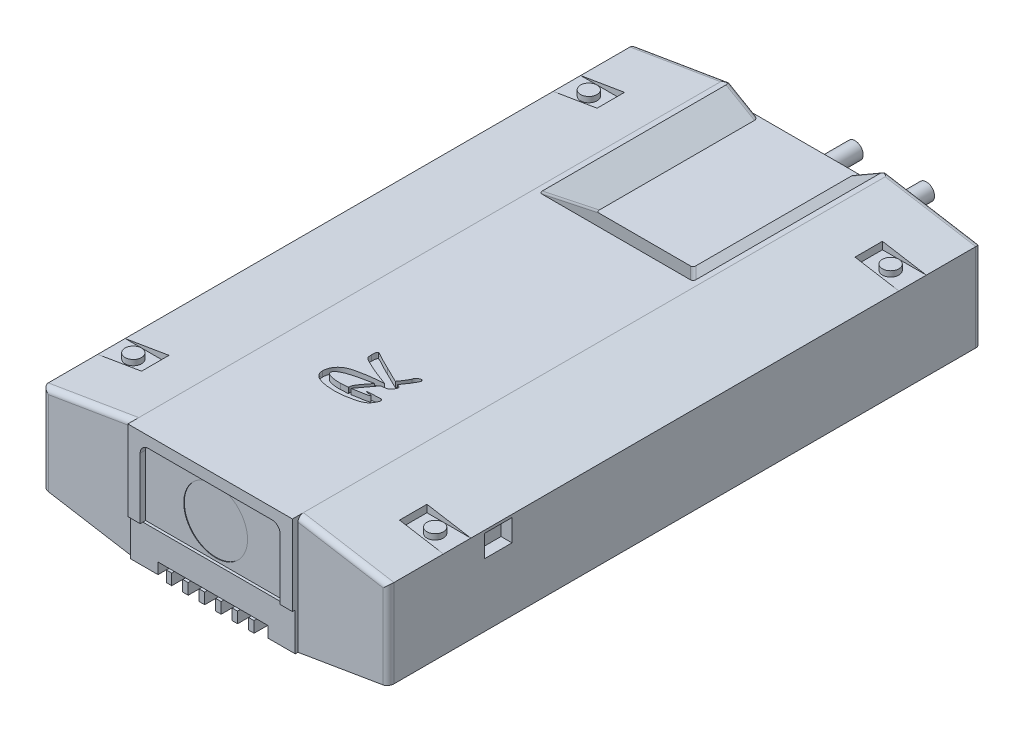
from build123d import *

# Parameters (mm, degrees)
EXTRUDE_1_DEPTH        = 109
SKETCH_2_W             = 20
SKETCH_2_H             = 4
CUT_EXTRUDE_1_DEPTH    = 109
SKETCH_5_R             = 3
EXTRUDE_2_DEPTH        = 5
SKETCH_6_R             = 1.5
EXTRUDE_3_DEPTH        = 10
SKETCH_7_W             = 28
SKETCH_7_H             = 50
CUT_EXTRUDE_3_DEPTH    = 3
CUT_EXTRUDE_3_DRAFT    = -60
CUT_EXTRUDE_4_DEPTH    = 1
SKETCH_9_OUTSIDE_W     = 93.148
SKETCH_9_OUTSIDE_H     = 51.688
SKETCH_9_OUTSIDE_W_2   = 30
SKETCH_9_OUTSIDE_H_2   = 21.54
CUT_EXTRUDE_5_DEPTH    = 1
SKETCH_10_W            = 30
SKETCH_10_H            = 6.9196852
CUT_EXTRUDE_6_DEPTH    = 1
EXTRUDE_7_DEPTH        = 0.5
SKETCH_11_W            = 8
SKETCH_11_H            = 5
CUT_EXTRUDE_7_DEPTH    = 2.77
SKETCH_25_R            = 5.8101574
CUT_EXTRUDE_12_DEPTH   = 0.1
SKETCH_13_W            = 5
SKETCH_13_H            = 4
CUT_EXTRUDE_9_DEPTH    = 2
SKETCH_15_W            = 1
SKETCH_15_H            = 2
EXTRUDE_4_DEPTH        = 109
SKETCH_16_R            = 1.5
EXTRUDE_5_DEPTH        = 1
FILLET_1_R             = 1
SKETCH_22_W            = 6.062177826
SKETCH_22_H            = 3.5
EXTRUDE_6_DEPTH        = 2
HOLE_WIZARD_M2_1_D     = 1.6
HOLE_WIZARD_M2_1_DEPTH = 4
HOLE_WIZARD_M2_1_TIP   = 0.480688495


with BuildPart() as part:
    # 草图1 → 凸台-拉伸1 (new body)
    with BuildSketch(Plane.XY):
        Polygon((-15, 10.77), (-31.5, 8), (-31.5, -8), (-15, -10.77), (15, -10.77), (31.5, -8), (31.5, 8), (15, 10.77), align=None)
    extrude(amount=EXTRUDE_1_DEPTH)

    # 草图2 → 切除-拉伸1 (cut)
    with BuildSketch(Plane.XY.offset(109)):
        with Locations((0, -10.77)):
            Rectangle(SKETCH_2_W, SKETCH_2_H)
    extrude(amount=-CUT_EXTRUDE_1_DEPTH, mode=Mode.SUBTRACT)

    # 草图5 → 凸台-拉伸2 (add)
    with BuildSketch(Plane(origin=(0, 0, 0), x_dir=(-1, 0, 0), z_dir=(0, 0, -1))):
        with Locations((-6.5, -3.77)):
            Circle(SKETCH_5_R)
        with Locations(Location((6.5, -3.77, 0), (0, 0, 180))):
            Circle(SKETCH_5_R)
    extrude(amount=EXTRUDE_2_DEPTH)

    # 草图6 → 凸台-拉伸3 (add)
    with BuildSketch(Plane(origin=(0, 0, -5), x_dir=(-1, 0, 0), z_dir=(0, 0, -1))):
        with Locations((-6.5, -3.77)):
            Circle(SKETCH_6_R)
        with Locations(Location((6.5, -3.77, 0), (0, 0, 180))):
            Circle(SKETCH_6_R)
    extrude(amount=EXTRUDE_3_DEPTH)


with BuildPart() as cut_extrude_3_tool:
    # 草图7 → 切除-拉伸3 (with draft: the straight prism first)
    with BuildSketch(Plane(origin=(0, 10.77, 0), x_dir=(1, 0, 0), z_dir=(0, 1, 0))):
        with Locations((0, -10)):
            Rectangle(SKETCH_7_W, SKETCH_7_H)
    extrude(amount=-CUT_EXTRUDE_3_DEPTH)
    # 切除-拉伸3: the draft: its side faces are tilted about the plane it starts from
    cut_extrude_3_sides = [cut_extrude_3_tool.faces().sort_by_distance(p)[0] for p in [
        (14, 9.27, 10),
        (0, 9.27, -15),
        (-14, 9.27, 10),
        (0, 9.27, 35),
    ]]
    draft(cut_extrude_3_sides, Plane(origin=(0, 10.77, 0), x_dir=(1, 0, 0), z_dir=(0, 1, 0)), CUT_EXTRUDE_3_DRAFT)


with BuildPart() as part_1:
    add(part.part)

    # 切除-拉伸3: cut by cut_extrude_3_tool
    add(cut_extrude_3_tool.part, mode=Mode.SUBTRACT)

    # 草图8 → 切除-拉伸4 (cut)
    with BuildSketch(Plane(origin=(0, 10.77, 0), x_dir=(1, 0, 0), z_dir=(0, 1, 0))):
        with BuildLine():
            Line((-0.091520411, -76.564537784), (2.64396346, -77.902172193))
            add(Edge.make_bspline(
                [(2.64396346, -77.902172193), (2.725905855, -77.789789697), (2.882375365, -77.575194627), (3.101687638, -77.267143229), (3.291495381, -76.986659861), (3.453486994, -76.73649393), (3.584347164, -76.513771452), (3.691704307, -76.323337104), (3.76909467, -76.160399066), (3.803161726, -76.058745125), (3.818157009, -76.01400015)],
                knots=[0, 0, 0, 0, 1.496497705, 2.857571612, 4.068387203, 5.140297685, 6.063603348, 6.847221219, 7.492581812, 8, 8, 8, 8], degree=3))
            add(Edge.make_bspline(
                [(3.818157009, -76.01400015), (3.83529868, -75.95857865), (3.869207697, -75.848945901), (3.959186877, -75.700833924), (4.072227864, -75.5676167), (4.208177919, -75.455472485), (4.349670891, -75.363307957), (4.48558258, -75.296533491), (4.60879672, -75.250594689), (4.688811363, -75.244681889), (4.72568389, -75.241957139)],
                knots=[0, 0, 0, 0, 1.100917803, 2.177794642, 3.271921831, 4.414937538, 5.520499694, 6.478917125, 7.299051179, 8, 8, 8, 8], degree=3))
            add(Edge.make_bspline(
                [(4.72568389, -75.241957139), (4.767396068, -75.244083061), (4.843908451, -75.247982627), (4.942710034, -75.306651425), (5.001378832, -75.405453008), (5.005278398, -75.481965391), (5.00740432, -75.523677569)],
                knots=[0, 0, 0, 0, 1.090337967, 2, 2.909662033, 4, 4, 4, 4], degree=3))
            add(Edge.make_bspline(
                [(5.00740432, -75.523677569), (5.005824937, -75.540285238), (5.001962692, -75.58089785), (4.976906424, -75.649192874), (4.943315224, -75.737915547), (4.892821191, -75.844178447), (4.83038237, -75.969962391), (4.752127331, -76.113282261), (4.662161766, -76.277326031), (4.517968901, -76.526632559), (4.311118774, -76.864534119), (4.030467668, -77.293706794), (3.710164175, -77.753068723), (3.47845594, -78.066194022), (3.357941955, -78.229053913)],
                knots=[0, 0, 0, 0, 0.188132264, 0.460061123, 0.817035427, 1.263432955, 1.789395896, 2.40630876, 3.11060897, 3.906392732, 5.66469425, 7.592663984, 9.707696365, 12, 12, 12, 12], degree=3))
            add(Edge.make_bspline(
                [(3.357941955, -78.229053913), (3.414663066, -78.249616967), (3.518569737, -78.28728616), (3.657732146, -78.341248812), (3.764283286, -78.391913019), (3.858863249, -78.440441623), (3.945128241, -78.50757518), (3.95982262, -78.582073675), (3.966544105, -78.616150687)],
                knots=[0, 0, 0, 0, 1.437946326, 2.634155327, 3.559063303, 4.239544776, 5.194734684, 6, 6, 6, 6], degree=3))
            add(Edge.make_bspline(
                [(3.966544105, -78.616150687), (3.962718767, -78.661711593), (3.954245493, -78.762630788), (3.893594463, -78.920212353), (3.805261881, -79.09868967), (3.686639636, -79.285965084), (3.558403612, -79.466432873), (3.421366531, -79.611010845), (3.293921637, -79.721754566), (3.179370542, -79.779359738), (3.080461248, -79.807940714), (2.988442814, -79.828781176), (2.876522564, -79.850125193), (2.744403972, -79.871170034), (2.592378036, -79.894431673), (2.42000085, -79.921681169), (2.226716021, -79.943442547), (2.091257773, -79.960109207), (2.020307546, -79.968838859)],
                knots=[0, 0, 0, 0, 0.8326692, 1.844394952, 3.058199613, 4.477232501, 5.893354799, 7.099201862, 8.114912972, 8.965152692, 9.41726811, 9.996115806, 10.690416172, 11.500904768, 12.442940529, 13.503609917, 14.692442539, 16, 16, 16, 16], degree=3))
            add(Edge.make_bspline(
                [(2.020307546, -79.968838859), (1.953019968, -80.062814919), (1.811020917, -80.261135495), (1.584862232, -80.572710272), (1.33629011, -80.915118691), (1.060411459, -81.283507257), (0.762764386, -81.68320511), (0.44139745, -82.112802617), (0.092583185, -82.569460908), (-0.146776683, -82.88420636), (-0.270015034, -83.046258214)],
                knots=[0, 0, 0, 0, 0.723073879, 1.525925102, 2.408566001, 3.370065053, 4.4051079, 5.526251042, 6.72634981, 8, 8, 8, 8], degree=3))
            add(Edge.make_bspline(
                [(-0.270015034, -83.046258214), (-0.127322534, -83.023563009), (0.145257649, -82.980209201), (0.534875486, -82.914318377), (0.888130944, -82.858148146), (1.20305497, -82.800831609), (1.481530984, -82.752489303), (1.721336929, -82.706288641), (1.92491645, -82.669530903), (2.092769529, -82.630807894), (2.234220151, -82.599968518), (2.352623074, -82.564408809), (2.45366563, -82.532022326), (2.538324956, -82.504062595), (2.603012438, -82.471609929), (2.649350331, -82.441676942), (2.682615493, -82.412217586), (2.687159475, -82.387940756), (2.689124751, -82.37744101)],
                knots=[0, 0, 0, 0, 2.261035033, 4.319171232, 6.183668484, 7.85829099, 9.328217939, 10.606514384, 11.680153538, 12.564731191, 13.302130519, 13.944690567, 14.498131009, 14.962962724, 15.339221697, 15.622348067, 15.836665272, 16, 16, 16, 16], degree=3))
            add(Edge.make_bspline(
                [(2.689124751, -82.37744101), (2.684264671, -82.361193876), (2.673090716, -82.323839599), (2.605546396, -82.289652735), (2.511093009, -82.275187149), (2.435567612, -82.273201113), (2.392350557, -82.272064666)],
                knots=[0, 0, 0, 0, 0.580194345, 1.333942381, 2.474431612, 4, 4, 4, 4], degree=3))
            add(Edge.make_bspline(
                [(2.392350557, -82.272064666), (2.332123057, -82.27172501), (2.219514522, -82.27108995), (2.062493425, -82.264681026), (1.928765594, -82.254958987), (1.820184087, -82.23934219), (1.733378394, -82.22490605), (1.674163396, -82.200929639), (1.628547742, -82.176864134), (1.621317185, -82.150328818), (1.618157009, -82.138731332)],
                knots=[0, 0, 0, 0, 1.779756817, 3.327646092, 4.645447512, 5.736067727, 6.57952918, 7.216874639, 7.657728404, 8, 8, 8, 8], degree=3))
            add(Edge.make_bspline(
                [(1.618157009, -82.138731332), (1.625488592, -82.1241962), (1.645482619, -82.084557307), (1.709479526, -82.0802829), (1.772461793, -82.072518491), (1.846360178, -82.069916268), (1.950619701, -82.06216295), (2.086326653, -82.057045087), (2.251789412, -82.047420907), (2.448243407, -82.03915652), (2.676242716, -82.03106732), (2.924970615, -82.020524014), (3.172253954, -82.009803339), (3.396688926, -82.001991761), (3.587318466, -81.992879089), (3.744295149, -81.986112374), (3.866942604, -81.982603831), (3.955062748, -81.978097979), (4.009537089, -81.975104075), (4.0346437, -81.975249069), (4.041812923, -81.975290472)],
                knots=[0, 0, 0, 0, 0.341839427, 0.932233426, 1.234121291, 1.772302116, 2.548027042, 3.544651668, 4.763010328, 6.202338316, 7.878492968, 9.792110166, 11.689939417, 13.334513912, 14.742270004, 15.896755576, 16.797997232, 17.446630437, 17.841984669, 18, 18, 18, 18], degree=3))
            add(Edge.make_bspline(
                [(4.041812923, -81.975290472), (4.089283668, -81.979674887), (4.183876807, -81.988411542), (4.296220579, -82.076030391), (4.384213892, -82.183777251), (4.39401364, -82.273422085), (4.39880217, -82.317225956)],
                knots=[0, 0, 0, 0, 1.029618247, 2.051680903, 3.047977291, 4, 4, 4, 4], degree=3))
            add(Edge.make_bspline(
                [(4.39880217, -82.317225956), (4.396781468, -82.350308449), (4.392477519, -82.42077175), (4.36698111, -82.531924884), (4.325437905, -82.653803981), (4.268398097, -82.78770455), (4.197721834, -82.933988749), (4.109049116, -83.091061376), (4.001865003, -83.258061307), (3.885013368, -83.439633682), (3.74015813, -83.621184092), (3.55724364, -83.79018392), (3.34192124, -83.949345496), (3.089383813, -84.094232756), (2.805568276, -84.23268947), (2.484455891, -84.355695139), (2.131029238, -84.472127789), (1.613769129, -84.60671512), (0.944401649, -84.748787121), (0.13064157, -84.870018933), (-0.6849001, -84.949987344), (-1.229685825, -84.958251979), (-1.502273099, -84.962387246)],
                knots=[0, 0, 0, 0, 0.283980889, 0.604858617, 0.974388117, 1.387877851, 1.852743683, 2.367681186, 2.934209261, 3.555114353, 4.219800971, 4.920313203, 5.685424958, 6.512404425, 7.414633145, 8.392277615, 9.460039323, 10.605777228, 12.976065362, 15.32715758, 17.661911247, 20, 20, 20, 20], degree=3))
            add(Edge.make_bspline(
                [(-1.502273099, -84.962387246), (-1.647812449, -84.960397668), (-1.932596292, -84.956504565), (-2.350996792, -84.935954805), (-2.750578845, -84.896947445), (-3.131712352, -84.843757424), (-3.493448747, -84.774965684), (-3.837142657, -84.692027735), (-4.160918548, -84.589778726), (-4.466252607, -84.4789936), (-4.743240152, -84.348056408), (-4.985786867, -84.194014851), (-5.192058773, -84.020079902), (-5.36116158, -83.823605794), (-5.491352642, -83.60589097), (-5.585574101, -83.367976816), (-5.639105335, -83.108834727), (-5.646740161, -82.929654558), (-5.650660196, -82.837656064)],
                knots=[0, 0, 0, 0, 1.348395218, 2.638469754, 3.879476062, 5.06660936, 6.202365147, 7.289592758, 8.339845241, 9.346419286, 10.296925271, 11.171983085, 12.001077916, 12.787671191, 13.562144269, 14.340310069, 15.147846683, 16, 16, 16, 16], degree=3))
            add(Edge.make_bspline(
                [(-5.650660196, -82.837656064), (-5.646090573, -82.735599918), (-5.636874844, -82.529779497), (-5.574445606, -82.220731033), (-5.469094353, -81.912903417), (-5.328041046, -81.605176338), (-5.145501056, -81.307275915), (-4.923061328, -81.024892983), (-4.656258298, -80.768357556), (-4.408454032, -80.562791431), (-4.172590231, -80.412311599), (-3.956610727, -80.301115372), (-3.704075768, -80.195431527), (-3.416898537, -80.088874598), (-3.092270647, -79.990287529), (-2.732062747, -79.890016847), (-2.334772476, -79.797489604), (-1.751950639, -79.672301876), (-0.980453864, -79.535179794), (-0.019117608, -79.402726327), (0.980064384, -79.300338976), (1.659543266, -79.260219101), (2.005253783, -79.239806601)],
                knots=[0, 0, 0, 0, 0.659393715, 1.329823804, 2.028541187, 2.758085759, 3.512798636, 4.281078793, 5.073757904, 5.9006316, 6.356798012, 6.878896526, 7.468272227, 8.124828844, 8.85738186, 9.659759893, 10.540610851, 11.492739365, 13.511685472, 15.602076924, 17.762390711, 20, 20, 20, 20], degree=3))
            add(Edge.make_bspline(
                [(2.005253783, -79.239806601), (1.830240539, -79.174847397), (1.48910038, -79.048227303), (0.991799092, -78.858444081), (0.522236594, -78.67641227), (0.080279061, -78.501350887), (-0.33424816, -78.336228261), (-0.721808089, -78.179625903), (-1.081119496, -78.029399502), (-1.412365442, -77.884479587), (-1.717994278, -77.74953387), (-1.996903569, -77.621906482), (-2.251884326, -77.506939489), (-2.479376614, -77.396906078), (-2.682187518, -77.295665403), (-2.85929017, -77.203953858), (-3.01207021, -77.122120594), (-3.173655939, -77.026369177), (-3.336827185, -76.916685231), (-3.490762614, -76.790153428), (-3.598088346, -76.672702905), (-3.657359052, -76.55082593), (-3.673419246, -76.417738217), (-3.692931233, -76.264061917), (-3.698718837, -76.075643156), (-3.70102397, -75.939427142), (-3.702273099, -75.865613053)],
                knots=[0, 0, 0, 0, 1.917324767, 3.737297031, 5.466877823, 7.089741232, 8.61962225, 10.049714465, 11.382899657, 12.619386351, 13.763138839, 14.814226988, 15.769653832, 16.635712605, 17.409477916, 18.097706039, 18.684124971, 19.189195882, 20.026453761, 20.700476139, 21.233127762, 21.648115249, 22.066938373, 22.600301893, 23.241517653, 24, 24, 24, 24], degree=3))
            add(Edge.make_bspline(
                [(-3.702273099, -75.865613053), (-3.701065485, -75.801096472), (-3.698756565, -75.67774275), (-3.691842306, -75.499628026), (-3.67306887, -75.33692847), (-3.654280652, -75.190516284), (-3.625004256, -75.065004391), (-3.570484408, -74.972151857), (-3.496240945, -74.908135508), (-3.436030154, -74.902751658), (-3.405498905, -74.900021655)],
                knots=[0, 0, 0, 0, 1.415363504, 2.706131608, 3.907634167, 5.003812181, 5.949771722, 6.70477342, 7.343225939, 8, 8, 8, 8], degree=3))
            add(Edge.make_bspline(
                [(-3.405498905, -74.900021655), (-3.388175687, -74.900754327), (-3.349213384, -74.902402207), (-3.287322025, -74.922867065), (-3.212057097, -74.948144662), (-3.126102585, -74.987830154), (-3.026590688, -75.03464519), (-2.916034104, -75.093426953), (-2.794617423, -75.165036772), (-2.654499276, -75.247408845), (-2.486029179, -75.345439472), (-2.277532532, -75.461119195), (-2.023231628, -75.597032004), (-1.722670962, -75.749443407), (-1.38018081, -75.928190173), (-0.990956955, -76.122560403), (-0.556667702, -76.337862605), (-0.251470462, -76.486591062), (-0.091520411, -76.564537784)],
                knots=[0, 0, 0, 0, 0.223024837, 0.501613553, 0.835509317, 1.250173402, 1.72237332, 2.256767045, 2.86670268, 3.543297265, 4.356544778, 5.384638476, 6.623380337, 8.081270929, 9.737987244, 11.614076477, 13.701392404, 16, 16, 16, 16], degree=3))
        make_face()
        with BuildLine():
            add(Edge.make_bspline(
                [(-0.659262346, -83.119376494), (-0.667478339, -83.085844341), (-0.683078261, -83.02217596), (-0.687348592, -82.956781392), (-0.689369873, -82.925828107)],
                knots=[0, 0, 0, 0, 1.053337702, 2, 2, 2, 2], degree=3))
            add(Edge.make_bspline(
                [(-0.689369873, -82.925828107), (-0.687381052, -82.892021503), (-0.68315124, -82.820121848), (-0.657375819, -82.707868869), (-0.618789314, -82.584514009), (-0.56136486, -82.45160984), (-0.490747664, -82.307821847), (-0.40316969, -82.153900309), (-0.300703974, -81.989524901), (-0.136688416, -81.750526085), (0.094665314, -81.431284555), (0.40083619, -81.024074067), (0.741727872, -80.586423), (0.984630251, -80.287393971), (1.110630127, -80.132279719)],
                knots=[0, 0, 0, 0, 0.362472189, 0.770903387, 1.230234846, 1.746863988, 2.320780788, 2.947000051, 3.6442504, 4.396615073, 6.053684974, 7.87027661, 9.857803457, 12, 12, 12, 12], degree=3))
            add(Edge.make_bspline(
                [(1.110630127, -80.132279719), (0.969402237, -80.159471997), (0.692608665, -80.21276634), (0.285928055, -80.291910286), (-0.102731101, -80.37096815), (-0.472966456, -80.451599631), (-0.825405772, -80.52768247), (-1.159051284, -80.606214982), (-1.47551853, -80.680806417), (-1.773940017, -80.755425358), (-2.054345721, -80.83224722), (-2.317597324, -80.903053313), (-2.561969214, -80.978234425), (-2.789285519, -81.047482776), (-2.998591857, -81.118792461), (-3.189110346, -81.189640337), (-3.362424393, -81.258052734), (-3.56322244, -81.347783882), (-3.78576398, -81.458724984), (-4.024946069, -81.590188368), (-4.224161134, -81.726150402), (-4.391423459, -81.85706026), (-4.522153009, -81.989062715), (-4.614777755, -82.122827749), (-4.677422857, -82.256071656), (-4.684036405, -82.348170147), (-4.687219335, -82.392494773)],
                knots=[0, 0, 0, 0, 1.607750534, 3.151041993, 4.63147132, 6.041314831, 7.386811043, 8.661957188, 9.872863476, 11.021501471, 12.100345205, 13.122963168, 14.068584232, 14.958221566, 15.779277644, 16.539922497, 17.230382487, 17.86176913, 18.997815234, 20.009669994, 20.909819811, 21.690750976, 22.382140378, 22.975622788, 23.50699369, 24, 24, 24, 24], degree=3))
            add(Edge.make_bspline(
                [(-4.687219335, -82.392494773), (-4.685587741, -82.425166356), (-4.682323358, -82.49053342), (-4.641378934, -82.583113044), (-4.582787676, -82.670054599), (-4.500604202, -82.751568548), (-4.393774439, -82.822976971), (-4.265493826, -82.890187357), (-4.113482268, -82.949128901), (-3.874997217, -83.025616433), (-3.537121269, -83.097993284), (-3.094935739, -83.165637433), (-2.605410535, -83.202845894), (-2.263620062, -83.207347458), (-2.085068798, -83.209699074)],
                knots=[0, 0, 0, 0, 0.402231409, 0.804757025, 1.233486946, 1.698340089, 2.228175501, 2.82026632, 3.490036926, 4.245787239, 5.922451112, 7.764336347, 9.787290282, 12, 12, 12, 12], degree=3))
            add(Edge.make_bspline(
                [(-2.085068798, -83.209699074), (-1.84756927, -83.205348254), (-1.370948493, -83.196616904), (-0.897028572, -83.145181634), (-0.659262346, -83.119376494)],
                knots=[0, 0, 0, 0, 0.99659746, 2, 2, 2, 2], degree=3))
        make_face(mode=Mode.SUBTRACT)
    extrude(amount=-CUT_EXTRUDE_4_DEPTH, mode=Mode.SUBTRACT)

    # 草图9 outside → 切除-拉伸5 (cut)
    with BuildSketch(Plane.XY.offset(109)):
        Rectangle(SKETCH_9_OUTSIDE_W, SKETCH_9_OUTSIDE_H)
        Rectangle(SKETCH_9_OUTSIDE_W_2, SKETCH_9_OUTSIDE_H_2, mode=Mode.SUBTRACT)
    extrude(amount=-CUT_EXTRUDE_5_DEPTH, mode=Mode.SUBTRACT)

    # 草图10 → 切除-拉伸6 (cut)
    with BuildSketch(Plane.XY.offset(109)):
        with Locations((0, -7.3101574)):
            Rectangle(SKETCH_10_W, SKETCH_10_H)
        with BuildLine():
            Line((-12.757070391, -3.8503148), (12.757070391, -3.8503148))
            Line((12.757070391, -3.8503148), (12.757070391, 7.27))
            ThreePointArc((12.757070391, 7.27), (12.317730563, 8.330660172), (11.257070391, 8.77))
            Line((11.257070391, 8.77), (-11.257070391, 8.77))
            ThreePointArc((-11.257070391, 8.77), (-12.317730563, 8.330660172), (-12.757070391, 7.27))
            Line((-12.757070391, 7.27), (-12.757070391, -3.8503148))
        make_face()
    extrude(amount=-CUT_EXTRUDE_6_DEPTH, mode=Mode.SUBTRACT)

    # 草图23 → 凸台-拉伸7 (add)
    with BuildSketch(Plane.XY.offset(108)):
        Polygon((-15, -3.8503148), (-15, -10.77), (-10, -10.77), (-10, -8.77), (10, -8.77), (10, -10.77), (15, -10.77), (15, -3.8503148), (12.757070391, -3.8503148), (-12.757070391, -3.8503148), align=None)
    extrude(amount=EXTRUDE_7_DEPTH)

    # 草图11 → 切除-拉伸7 (cut)
    with BuildSketch(Plane(origin=(0, 10.77, 0), x_dir=(1, 0, 0), z_dir=(0, 1, 0))):
        with Locations((-27.5, -95.5)):
            Rectangle(SKETCH_11_W, SKETCH_11_H)
        with Locations((-27.5, -12.5)):
            Rectangle(SKETCH_11_W, SKETCH_11_H)
        with Locations((27.5, -12.5)):
            Rectangle(SKETCH_11_W, SKETCH_11_H)
        with Locations((27.5, -95.5)):
            Rectangle(SKETCH_11_W, SKETCH_11_H)
    extrude(amount=-CUT_EXTRUDE_7_DEPTH, mode=Mode.SUBTRACT)

    # 草图25 → 切除-拉伸12 (cut)
    with BuildSketch(Plane.XY.offset(108)):
        with Locations((0, 2.4598426)):
            Circle(SKETCH_25_R)
    extrude(amount=-CUT_EXTRUDE_12_DEPTH, mode=Mode.SUBTRACT)

    # 草图13 → 切除-拉伸9 (cut)
    with BuildSketch(Plane(origin=(31.5, 0, 0), x_dir=(0, 0, -1), z_dir=(1, 0, 0))):
        with Locations((-88, 5.5)):
            Rectangle(SKETCH_13_W, SKETCH_13_H)
    cut_extrude_9 = extrude(amount=-CUT_EXTRUDE_9_DEPTH, mode=Mode.SUBTRACT)

    # 镜向1: 切除-拉伸9 across plane
    add(cut_extrude_9.mirror(Plane(origin=(0, 0, 0), x_dir=(0, 0, 1), z_dir=(1, 0, 0))), mode=Mode.SUBTRACT)

    # 草图15 → 凸台-拉伸4 (add)
    with BuildSketch(Plane.XY.offset(109)):
        with Locations((-7.5, -9.77)):
            Rectangle(SKETCH_15_W, SKETCH_15_H)
        with Locations((-4.5, -9.77)):
            Rectangle(SKETCH_15_W, SKETCH_15_H)
        with Locations((-1.5, -9.77)):
            Rectangle(SKETCH_15_W, SKETCH_15_H)
        with Locations((1.5, -9.77)):
            Rectangle(SKETCH_15_W, SKETCH_15_H)
        with Locations((4.5, -9.77)):
            Rectangle(SKETCH_15_W, SKETCH_15_H)
        with Locations((7.5, -9.77)):
            Rectangle(SKETCH_15_W, SKETCH_15_H)
    extrude(amount=-EXTRUDE_4_DEPTH)

    # 草图16 → 凸台-拉伸5 (add)
    with BuildSketch(Plane(origin=(0, 8, 0), x_dir=(1, 0, 0), z_dir=(0, 1, 0))):
        with Locations(Location((-27.5, -95.5, 0), (0, 0, 90))):
            Circle(SKETCH_16_R)
        with Locations(Location((-27.5, -12.5, 0), (0, 0, 90))):
            Circle(SKETCH_16_R)
        with Locations(Location((27.5, -95.5, 0), (0, 0, 90))):
            Circle(SKETCH_16_R)
        with Locations(Location((27.5, -12.5, 0), (0, 0, 270))):
            Circle(SKETCH_16_R)
    extrude(amount=EXTRUDE_5_DEPTH)

    # 圆角1
    # the kernel refuses this fillet: 1 mm, written as the material it adds along each edge
    with BuildSketch(Plane(origin=(-14.618589574, 11.127142857, 35.618589574), x_dir=(-0.5669467095138421, 0.3273268353539873, -0.7559289460184542), z_dir=(0.6546536707079779, -0.3779644730092255, -0.6546536707079776))) as fillet_1_piece_1_section:
        with BuildLine():
            CenterArc((FILLET_1_R * 0.377964473009, FILLET_1_R), FILLET_1_R, 228.590377891, 41.409622109)
            Line((-FILLET_1_R * 0.283473354757, FILLET_1_R * 0.25), (0, 0))
            Line((0, 0), (FILLET_1_R * 0.377964473009, 0))
        make_face()
    fillet_1_piece_1 = extrude(amount=9.827076298, mode=Mode.PRIVATE)
    fillet_1_piece_1 = split(fillet_1_piece_1, bisect_by=Plane(origin=(-11.297768565, 10.77, 32.297768565), z_dir=(0, -1, 0)), keep=Keep.TOP, mode=Mode.PRIVATE)
    add(fillet_1_piece_1)
    with BuildSketch(Plane(origin=(14.618589574, 11.127142857, 35.618589574), x_dir=(0.5669467095138422, 0.32732683535398743, -0.755928946018454), z_dir=(-0.6546536707079775, -0.37796447300922553, -0.6546536707079778))) as fillet_1_piece_2_section:
        with BuildLine():
            CenterArc((FILLET_1_R * 0.377964473009, -FILLET_1_R), FILLET_1_R, 90, 41.409622109)
            Line((-FILLET_1_R * 0.283473354757, -FILLET_1_R * 0.25), (0, 0))
            Line((0, 0), (FILLET_1_R * 0.377964473009, 0))
        make_face()
    fillet_1_piece_2 = extrude(amount=9.827076298, mode=Mode.PRIVATE)
    fillet_1_piece_2 = split(fillet_1_piece_2, bisect_by=Plane(origin=(11.297768565, 10.77, 32.297768565), z_dir=(0, -1, 0)), keep=Keep.TOP, mode=Mode.PRIVATE)
    add(fillet_1_piece_2)
    # the kernel refuses this fillet: 1 mm, written as the material it takes off along each edge
    with BuildSketch(Plane(origin=(-12.534501524, 11.183904896, 0), x_dir=(0, 0, 1), z_dir=(-0.9861993905722961, -0.16556195829607617, 0))) as fillet_1_2_piece_1:
        with BuildLine():
            CenterArc((FILLET_1_R, -FILLET_1_R), FILLET_1_R, 90, 90)
            Line((0, -FILLET_1_R), (0, 0))
            Line((0, 0), (FILLET_1_R, 0))
        make_face()
    extrude(amount=21.730896569, mode=Mode.SUBTRACT)
    with BuildSketch(Plane(origin=(-12.534501524, 11.183904896, 108), x_dir=(0, 0, -1), z_dir=(-0.9861993905722962, -0.1655619582960762, 0))) as fillet_1_2_piece_2_section:
        with BuildLine():
            CenterArc((FILLET_1_R, FILLET_1_R), FILLET_1_R, 180, 90)
            Line((0, FILLET_1_R), (0, 0))
            Line((0, 0), (FILLET_1_R, 0))
        make_face()
    fillet_1_2_piece_2 = extrude(amount=21.730896569, mode=Mode.PRIVATE)
    fillet_1_2_piece_2 = split(fillet_1_2_piece_2, bisect_by=Plane(origin=(-15, 8.952037144, 107.773364724), z_dir=(-1, 0, 0)), keep=Keep.TOP, mode=Mode.PRIVATE)
    add(fillet_1_2_piece_2, mode=Mode.SUBTRACT)
    with BuildSketch(Plane(origin=(-31.5, 10.5, 108), x_dir=(0, 0, -1), z_dir=(0, -1, 0)), Plane(origin=(31.5, -10.5, 108), x_dir=(0, 0, -1), z_dir=(0, 1, 0)), Plane(origin=(31.5, -10.5, 0), x_dir=(-1, 0, 0), z_dir=(0, 1, 0)), Plane(origin=(-31.5, 10.5, 0), x_dir=(1, 0, 0), z_dir=(0, -1, 0))) as fillet_1_2_piece_3:
        with BuildLine():
            CenterArc((FILLET_1_R, FILLET_1_R), FILLET_1_R, 180, 90)
            Line((0, FILLET_1_R), (0, 0))
            Line((0, 0), (FILLET_1_R, 0))
        make_face()
    extrude(amount=21, mode=Mode.SUBTRACT)
    with BuildSketch(Plane(origin=(33.965498476, 7.586095104, 108), x_dir=(0, 0, -1), z_dir=(-0.9861993905722962, 0.165561958296076, 0))) as fillet_1_2_piece_4_section:
        with BuildLine():
            CenterArc((FILLET_1_R, FILLET_1_R), FILLET_1_R, 180, 90)
            Line((0, FILLET_1_R), (0, 0))
            Line((0, 0), (FILLET_1_R, 0))
        make_face()
    fillet_1_2_piece_4 = extrude(amount=21.730896569, mode=Mode.PRIVATE)
    fillet_1_2_piece_4 = split(fillet_1_2_piece_4, bisect_by=Plane(origin=(15, 8.952037144, 107.773364724), z_dir=(1, 0, 0)), keep=Keep.TOP, mode=Mode.PRIVATE)
    add(fillet_1_2_piece_4, mode=Mode.SUBTRACT)
    with BuildSketch(Plane(origin=(-16.165063509, 12.02, 0), x_dir=(-0.49999999999999784, -0.8660254037844399, 0), z_dir=(0.8660254037844399, -0.4999999999999979, 0))) as fillet_1_2_piece_5_section:
        with BuildLine():
            CenterArc((FILLET_1_R, -FILLET_1_R), FILLET_1_R, 90, 90)
            Line((0, -FILLET_1_R), (0, 0))
            Line((0, 0), (FILLET_1_R, 0))
        make_face()
    fillet_1_2_piece_5 = extrude(amount=11, mode=Mode.PRIVATE)
    fillet_1_2_piece_5 = split(fillet_1_2_piece_5, bisect_by=Plane(origin=(-12.755038674, 7.77, 0.232260576), z_dir=(0, 1, 0)), keep=Keep.TOP, mode=Mode.PRIVATE)
    add(fillet_1_2_piece_5, mode=Mode.SUBTRACT)
    with BuildSketch(Plane(origin=(6.638784068, 6.52, 0), x_dir=(0.49999999999999817, -0.8660254037844397, 0), z_dir=(0.8660254037844397, 0.4999999999999981, 0))) as fillet_1_2_piece_6_section:
        with BuildLine():
            CenterArc((FILLET_1_R, -FILLET_1_R), FILLET_1_R, 90, 90)
            Line((0, -FILLET_1_R), (0, 0))
            Line((0, 0), (FILLET_1_R, 0))
        make_face()
    fillet_1_2_piece_6 = extrude(amount=11, mode=Mode.PRIVATE)
    fillet_1_2_piece_6 = split(fillet_1_2_piece_6, bisect_by=Plane(origin=(12.755038674, 7.77, 0.232260576), z_dir=(0, 1, 0)), keep=Keep.TOP, mode=Mode.PRIVATE)
    add(fillet_1_2_piece_6, mode=Mode.SUBTRACT)
    with BuildSketch(Plane(origin=(33.965498476, 7.586095104, 0), x_dir=(-0.16556195829607598, -0.9861993905722962, 0), z_dir=(-0.9861993905722962, 0.165561958296076, 0))) as fillet_1_2_piece_7:
        with BuildLine():
            CenterArc((FILLET_1_R, FILLET_1_R), FILLET_1_R, 180, 90)
            Line((0, FILLET_1_R), (0, 0))
            Line((0, 0), (FILLET_1_R, 0))
        make_face()
    extrude(amount=21.730896569, mode=Mode.SUBTRACT)

    # 草图22 → 凸台-拉伸6 (add)
    with BuildSketch(Plane.XZ.offset(10.77)):
        with Locations((-7, 87.5)):
            Rectangle(SKETCH_22_W, SKETCH_22_H)
        with Locations((7, 87.5)):
            Rectangle(SKETCH_22_W, SKETCH_22_H)
        with Locations((7, 7.5)):
            Rectangle(SKETCH_22_W, SKETCH_22_H)
        with Locations((-7, 7.5)):
            Rectangle(SKETCH_22_W, SKETCH_22_H)
    extrude(amount=-EXTRUDE_6_DEPTH)

    # M2 螺纹孔1
    with Locations(Plane(origin=(-7, -10.77, 87.5), x_dir=(-1, 0, 0), z_dir=(0, -1, 0))):
        with Locations((0, 0), (-14, 0), (0, 80), (-14, 80)):
            Hole(HOLE_WIZARD_M2_1_D / 2, depth=HOLE_WIZARD_M2_1_DEPTH)
            with Locations((0, 0, -(HOLE_WIZARD_M2_1_DEPTH + HOLE_WIZARD_M2_1_TIP / 2))):  # 118° drill point
                Cone(0, HOLE_WIZARD_M2_1_D / 2, HOLE_WIZARD_M2_1_TIP, mode=Mode.SUBTRACT)


solid = part_1.part
